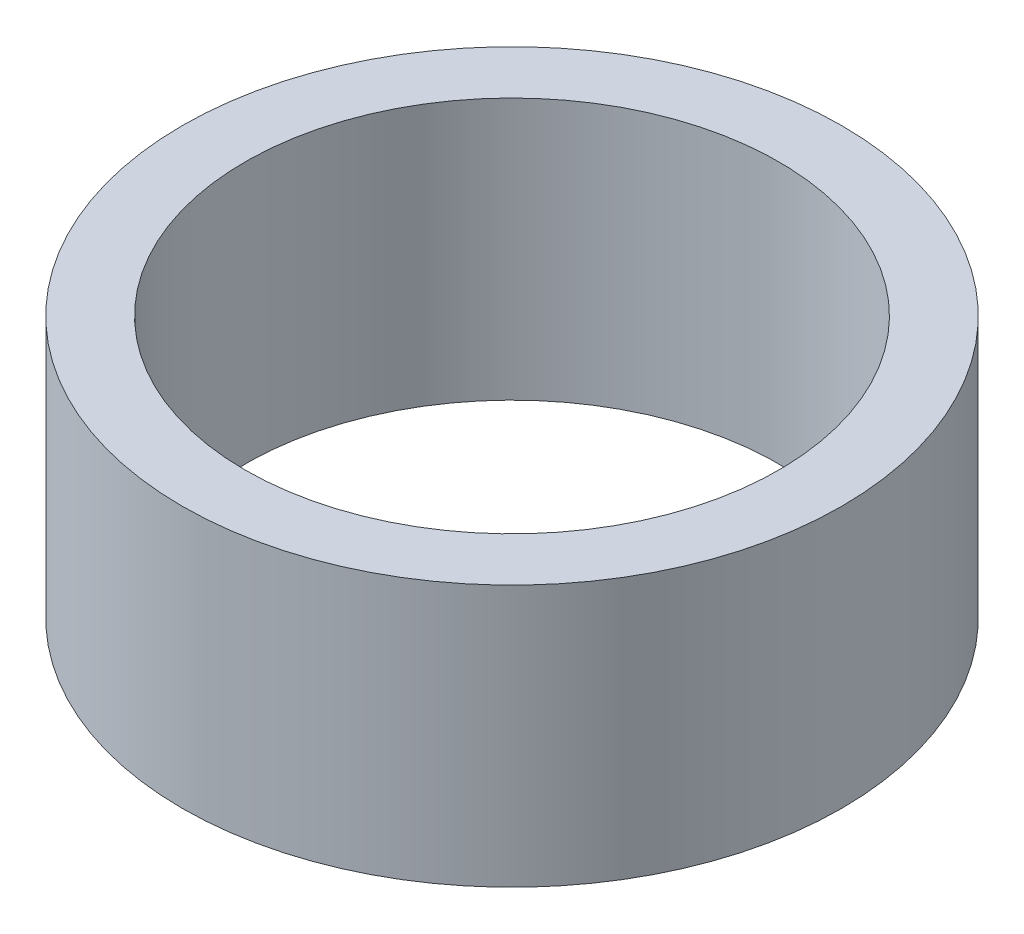
from build123d import *

# Parameters (mm, degrees)
SKETCH1_R           = 3.15
SKETCH1_R_2         = 2.55
BOSS_EXTRUDE1_DEPTH = 2.5


with BuildPart() as part:
    # Sketch1 → Boss-Extrude1 (new body)
    with BuildSketch(Plane(origin=(0, 0, 0), x_dir=(1, 0, 0), z_dir=(0, 1, 0))):
        Circle(SKETCH1_R)
        Circle(SKETCH1_R_2, mode=Mode.SUBTRACT)
    extrude(amount=BOSS_EXTRUDE1_DEPTH)


solid = part.part
